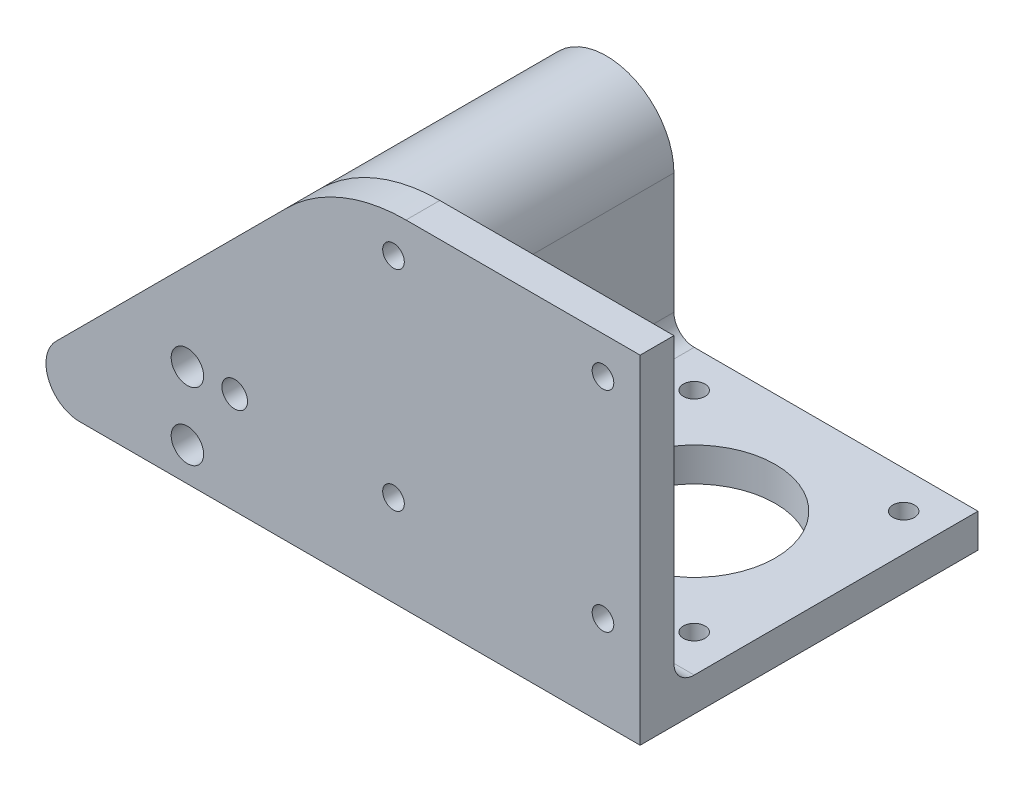
from build123d import *

# Parameters (mm, degrees)
SKETCH_1_R          = 1.6
SKETCH_1_R_2        = 12
EXTRUDE_1_DEPTH     = 5
SKETCH_4_W          = 45
SKETCH_4_H          = 50
SKETCH_4_R          = 1.6
EXTRUDE_4_DEPTH     = 5
SKETCH_5_W          = 50
SKETCH_5_H          = 50
EXTRUDE_5_DEPTH     = 50
SKETCH_6_R          = 2.4
SKETCH_6_R_2        = 1.9
CUT_EXTRUDE_1_DEPTH = 103.352332655
SKETCH_7_W          = 17
SKETCH_7_H          = 20
CUT_EXTRUDE_2_DEPTH = 45
SKETCH_8_R          = 1.8
CUT_EXTRUDE_3_DEPTH = 94.898881782
SKETCH_9_R          = 2.8
CUT_EXTRUDE_4_DEPTH = 45
CHAMFER_1_SIZE      = 50
FILLET_1_R          = 5
FILLET_2_R          = 10
FILLET_4_R          = 25
FILLET_5_R          = 3
FILLET_6_R          = 1.5


with BuildPart() as part:
    # 草图1 → 凸台-拉伸1 (new body)
    with BuildSketch(Plane(origin=(0, 0, 0), x_dir=(1, 0, 0), z_dir=(0, 1, 0))):
        Polygon((-24, -24), (-24, 21), (-21, 21), (21, 21), (21, -21), (21, -24), align=None)
        with Locations(Location((-15.5, 15.5, 0), (0, 0, 270))):
            Circle(SKETCH_1_R, mode=Mode.SUBTRACT)
        with Locations(Location((15.5, 15.5, 0), (0, 0, 270))):
            Circle(SKETCH_1_R, mode=Mode.SUBTRACT)
        with Locations(Location((-15.5, -15.5, 0), (0, 0, 270))):
            Circle(SKETCH_1_R, mode=Mode.SUBTRACT)
        with Locations(Location((15.5, -15.5, 0), (0, 0, 270))):
            Circle(SKETCH_1_R, mode=Mode.SUBTRACT)
        with Locations(Location((0, 0, 0), (0, 0, 270))):
            Circle(SKETCH_1_R_2, mode=Mode.SUBTRACT)
    extrude(amount=EXTRUDE_1_DEPTH)

    # 草图4 → 凸台-拉伸4 (add)
    with BuildSketch(Plane.XY.offset(24)):
        with Locations((-1.5, 25)):
            Rectangle(SKETCH_4_W, SKETCH_4_H)
        with Locations((-15.5, 44.5)):
            Circle(SKETCH_4_R, mode=Mode.SUBTRACT)
        with Locations((15.5, 44.5)):
            Circle(SKETCH_4_R, mode=Mode.SUBTRACT)
        with Locations((-15.5, 13.5)):
            Circle(SKETCH_4_R, mode=Mode.SUBTRACT)
        with Locations((15.5, 13.5)):
            Circle(SKETCH_4_R, mode=Mode.SUBTRACT)
    extrude(amount=EXTRUDE_4_DEPTH)

    # 草图5 → 凸台-拉伸5 (add)
    with BuildSketch(Plane.ZY.offset(24)):
        with Locations((4, 25)):
            Rectangle(SKETCH_5_W, SKETCH_5_H)
    extrude(amount=EXTRUDE_5_DEPTH)

    # 草图6 → 切除-拉伸1 (cut, through all)
    with BuildSketch(Plane(origin=(0, 0, -21), x_dir=(-1, 0, 0), z_dir=(0, 0, -1))):
        with Locations((46, 15)):
            Circle(SKETCH_6_R)
        with Locations((39, 15)):
            Circle(SKETCH_6_R_2)
        with Locations((46, 5)):
            Circle(SKETCH_6_R)
    extrude(amount=-CUT_EXTRUDE_1_DEPTH, mode=Mode.SUBTRACT)

    # 草图7 → 切除-拉伸2 (cut)
    with BuildSketch(Plane(origin=(0, 0, -21), x_dir=(-1, 0, 0), z_dir=(0, 0, -1))):
        with Locations((42.5, 10)):
            Rectangle(SKETCH_7_W, SKETCH_7_H)
    extrude(amount=-CUT_EXTRUDE_2_DEPTH, mode=Mode.SUBTRACT)

    # 草图8 → 切除-拉伸3 (cut, through all)
    with BuildSketch(Plane.XZ):
        with Locations(Location((-60.5, 19, 0), (0, 0, 270))):
            Circle(SKETCH_8_R)
    extrude(amount=-CUT_EXTRUDE_3_DEPTH, mode=Mode.SUBTRACT)

    # 草图9 → 切除-拉伸4 (cut)
    with BuildSketch(Plane(origin=(0, 50, 0), x_dir=(1, 0, 0), z_dir=(0, 1, 0))):
        with Locations(Location((-60.5, -19, 0), (0, 0, 270))):
            Circle(SKETCH_9_R)
    extrude(amount=-CUT_EXTRUDE_4_DEPTH, mode=Mode.SUBTRACT)

    # 倒角1
    # the kernel refuses this chamfer: 50 mm, written as the material it takes off along each edge
    with BuildSketch(Plane(origin=(-74, 50, 157.584149398), x_dir=(0.9996219169112966, 0.027495876610586317, 0), z_dir=(0, 0, -1))) as chamfer_1_piece_1:
        Polygon((CHAMFER_1_SIZE * 0.999621916911, CHAMFER_1_SIZE * 0.0274958766106), (-CHAMFER_1_SIZE * 0.0274958766106, CHAMFER_1_SIZE * 0.999621916911), (0, 0), align=None)
    extrude(amount=307.168298797, mode=Mode.SUBTRACT)

    # 圆角1
    # the kernel refuses this fillet: 5 mm, written as the material it takes off along each edge
    with BuildSketch(Plane(origin=(-74, 0, -51.17766953), x_dir=(0.707106781186265, 0.7071067811868301, 0), z_dir=(0, 0, 1))) as fillet_1_piece_1:
        with BuildLine():
            CenterArc((FILLET_1_R * 2.41421356237, -FILLET_1_R), FILLET_1_R, 90, 135)
            Line((FILLET_1_R * 1.70710678118, -FILLET_1_R * 1.70710678119), (0, 0))
            Line((0, 0), (FILLET_1_R * 2.41421356237, 0))
        make_face()
    extrude(amount=110.355339059, mode=Mode.SUBTRACT)

    # 圆角2
    fillet_2_edges = [part.edges().sort_by_distance(p)[0] for p in [
        (-24, 50, 1.5),
    ]]
    fillet(fillet_2_edges, radius=FILLET_2_R)

    # 圆角4
    fillet_4_edges = [part.edges().sort_by_distance(p)[0] for p in [
        (-24, 50, 26.5),
    ]]
    fillet(fillet_4_edges, radius=FILLET_4_R)

    # 圆角5
    fillet_5_edges = [part.edges().sort_by_distance(p)[0] for p in [
        (-24, 15.428932188, 24),
        (-30.173165676, 35.096659701, 24),
        (-24, 5, 1.5),
        (-1.5, 5, 24),
        (-51, 20, 1.5),
        (-34, 20, 1.5),
    ]]
    fillet(fillet_5_edges, radius=FILLET_5_R)

    # 圆角6
    fillet_6_edges = [part.edges().sort_by_distance(p)[0] for p in [
        (-42.5, 20, 24),
        (-51, 8.5, 24),
        (-50.121320344, 19.121320344, 24),
        (-34.878679656, 19.121320344, 24),
        (-34, 8.5, 24),
    ]]
    fillet(fillet_6_edges, radius=FILLET_6_R)


solid = part.part
